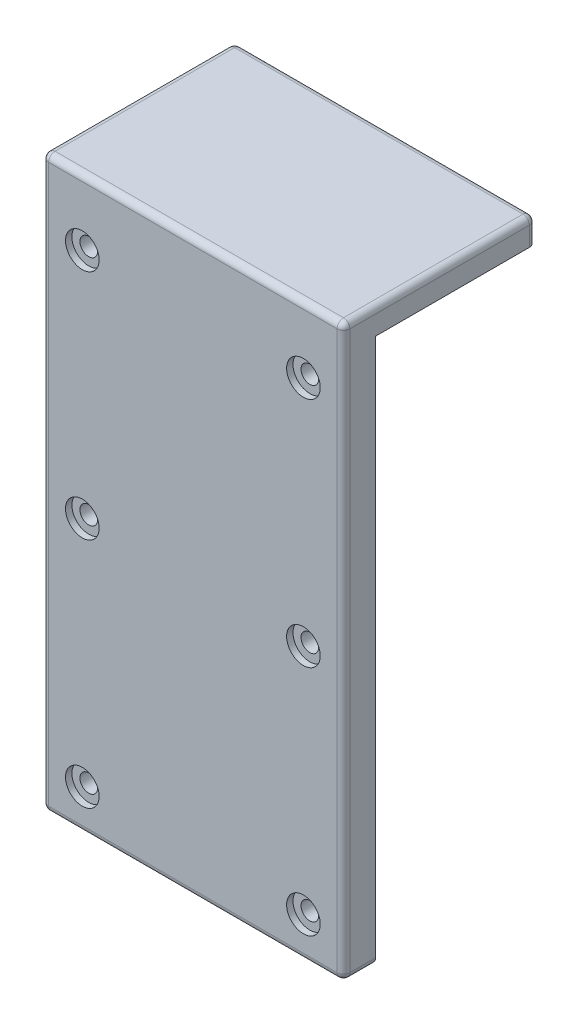
from build123d import *

# Parameters (mm, degrees)
SKETCH1_W                       = 94
SKETCH1_H                       = 170
BOSS_EXTRUDE1_DEPTH             = 10
CBORE_FOR_M5_SBHCS1_D           = 5.5
CBORE_FOR_M5_SBHCS1_CBORE_D     = 10.5
CBORE_FOR_M5_SBHCS1_CBORE_DEPTH = 2
SKETCH4_W                       = 94
SKETCH4_H                       = 60
BOSS_EXTRUDE2_DEPTH             = 8
FILLET1_R                       = 2
M4X0_7_TAPPED_HOLE1_D           = 3.3
M4X0_7_TAPPED_HOLE1_DEPTH       = 8


with BuildPart() as part:
    # Sketch1 → Boss-Extrude1 (new body)
    with BuildSketch(Plane.XY):
        with Locations((47, 85)):
            Rectangle(SKETCH1_W, SKETCH1_H)
    extrude(amount=BOSS_EXTRUDE1_DEPTH)

    # CBORE for M5 SBHCS1 (through all)
    with Locations(Plane.XY.offset(10)):
        with Locations((81.5, 157.5), (12.5, 85), (12.5, 157.5), (81.5, 85), (12.5, 12.5), (81.5, 12.5)):
            CounterBoreHole(CBORE_FOR_M5_SBHCS1_D / 2, CBORE_FOR_M5_SBHCS1_CBORE_D / 2, CBORE_FOR_M5_SBHCS1_CBORE_DEPTH)

    # Sketch4 → Boss-Extrude2 (add)
    with BuildSketch(Plane(origin=(0, 170, 0), x_dir=(1, 0, 0), z_dir=(0, 1, 0))):
        with Locations((47, 20)):
            Rectangle(SKETCH4_W, SKETCH4_H)
    extrude(amount=BOSS_EXTRUDE2_DEPTH)

    # Fillet1
    fillet1_edges = [part.edges().sort_by_distance(p)[0] for p in [
        (0, 174, -50),
        (94, 174, -50),
        (47, 178, -50),
        (94, 0, 5),
        (0, 0, 5),
        (47, 0, 10),
        (0, 89, 10),
        (0, 178, -20),
        (94, 178, -20),
        (94, 89, 10),
        (47, 178, 10),
    ]]
    fillet(fillet1_edges, radius=FILLET1_R)

    # M4x0.7 Tapped Hole1
    with Locations(Plane(origin=(0, 0, 0), x_dir=(-1, 0, 0), z_dir=(0, 0, -1))):
        with Locations((-47, 140), (-47, 49)):
            Hole(M4X0_7_TAPPED_HOLE1_D / 2, depth=M4X0_7_TAPPED_HOLE1_DEPTH)


solid = part.part
